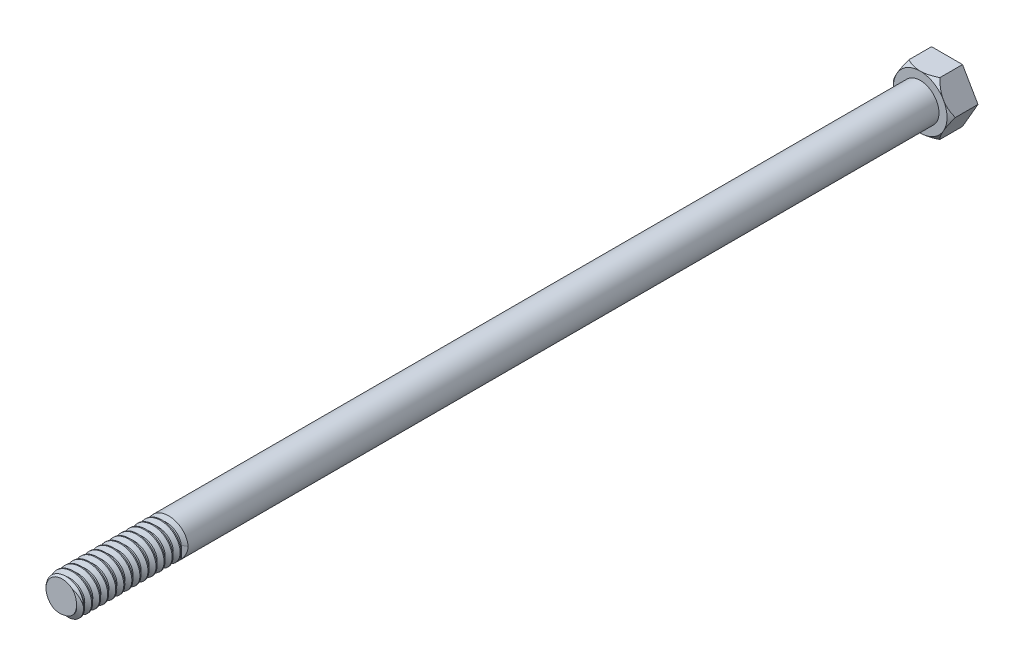
from build123d import *

# Parameters (mm, degrees)
BOSS_EXTRUDE1_DEPTH = 2.5
SKETCH3_OUTSIDE_W   = 37.02
SKETCH3_OUTSIDE_H   = 35.472
SKETCH3_OUTSIDE_R   = 5
CUT_EXTRUDE1_DEPTH  = 10.128709292
CUT_EXTRUDE1_DRAFT  = -45
SKETCH4_R           = 3.5
BOSS_EXTRUDE2_DEPTH = 160
CHAMFER1_SIZE       = 0.5
THREAD1_PITCH       = 1.5
CUT_EXTRUDE2_DEPTH  = 163.679388264
CUT_EXTRUDE4_DEPTH  = 2.5


with BuildPart() as part:
    # Sketch2 → Boss-Extrude1 (new, symmetric)
    with BuildSketch(Plane.XY):
        Polygon((-2.886751346, 5), (-5.773502692, 0), (-2.886751346, -5), (2.886751346, -5), (5.773502692, 0), (2.886751346, 5), align=None)
    extrude(amount=BOSS_EXTRUDE1_DEPTH, both=True)


with BuildPart() as cut_extrude1_tool:
    # Sketch3 outside → Cut-Extrude1 (with draft: the straight prism first)
    with BuildSketch(Plane.XY.offset(2.5)):
        Rectangle(SKETCH3_OUTSIDE_W, SKETCH3_OUTSIDE_H)
        Circle(SKETCH3_OUTSIDE_R, mode=Mode.SUBTRACT)
    extrude(amount=-CUT_EXTRUDE1_DEPTH)
    # Cut-Extrude1: the draft: its side faces are tilted about the plane it starts from
    cut_extrude1_sides = [cut_extrude1_tool.faces().sort_by_distance(p)[0] for p in [
        (0, -17.736, -2.564354646),
        (18.51, 0, -2.564354646),
        (0, 17.736, -2.564354646),
        (-18.51, 0, -2.564354646),
        (-5, 0, -2.564354646),
    ]]
    draft(cut_extrude1_sides, Plane.XY.offset(2.5), CUT_EXTRUDE1_DRAFT)


with BuildPart() as part_1:
    add(part.part)

    # Cut-Extrude1: cut by cut_extrude1_tool
    add(cut_extrude1_tool.part, mode=Mode.SUBTRACT)

    # Sketch4 → Boss-Extrude2 (add)
    with BuildSketch(Plane.XY.offset(2.5)):
        Circle(SKETCH4_R)
    extrude(amount=BOSS_EXTRUDE2_DEPTH)

    # Chamfer1
    chamfer1_edges = [part_1.edges().sort_by_distance(p)[0] for p in [
        (-3.5, 0, 162.5),
    ]]
    chamfer(chamfer1_edges, length=CHAMFER1_SIZE)

    # Thread1: the profile of Thread Profile1 profile screwed along a right-hand helix of 13.333333 turns, 8 arcs to a turn; built about Z, then put on its axis
    thread1_z = Axis((0, 0, 0), (0, 0, 1))
    thread1_corners = [(3.5003, 0, -0.000173205), (3.5003, 0, 1.312673201), (2.688101188, 0, 0.843749998), (2.688101188, 0, 0.468749998)]
    with BuildLine(mode=Mode.PRIVATE) as thread1_profile:
        Line(thread1_corners[0], thread1_corners[1])
        Line(thread1_corners[1], thread1_corners[2])
        Line(thread1_corners[2], thread1_corners[3])
        Line(thread1_corners[3], thread1_corners[0])
    thread1_cap = Face(thread1_profile.wire())
    thread1_turn_angles = [0, 22.5, 45, 67.5, 90, 112.5, 135, 157.5, 180, 202.5, 225, 247.5, 270, 292.5, 315, 337.5, 360]
    thread1_turn_weights = [1, 0.9238795325112867, 1, 0.9238795325112867, 1, 0.9238795325112867, 1, 0.9238795325112867, 1, 0.9238795325112867, 1, 0.9238795325112867, 1, 0.9238795325112867, 1, 0.9238795325112867, 1]
    thread1_turn_rails = [Edge.make_bspline([Vector(p[0], p[1], 0).rotate(thread1_z, thread1_turn_angles[k]) / thread1_turn_weights[k] + Vector(0, 0, p[2] + THREAD1_PITCH * thread1_turn_angles[k] / 360) for k in range(17)], [0, 0, 0, 1, 1, 2, 2, 3, 3, 4, 4, 5, 5, 6, 6, 7, 7, 8, 8, 8], 2, thread1_turn_weights) for p in thread1_corners]
    thread1_turn_sides = [Face.make_surface_from_curves(thread1_turn_rails[p[0]], thread1_turn_rails[p[1]]) for p in [(0, 1), (1, 2), (2, 3), (3, 0)]]
    thread1_last_angles = [4680, 4702.5, 4725, 4747.5, 4770, 4785, 4800]
    thread1_last_weights = [1, 0.9238795325112867, 1, 0.9238795325112867, 1, 0.9659258262890744, 1]
    thread1_last_rails = [Edge.make_bspline([Vector(p[0], p[1], 0).rotate(thread1_z, thread1_last_angles[k]) / thread1_last_weights[k] + Vector(0, 0, p[2] + THREAD1_PITCH * thread1_last_angles[k] / 360) for k in range(7)], [0, 0, 0, 1, 1, 2, 2, 3, 3, 3], 2, thread1_last_weights) for p in thread1_corners]
    thread1_last_sides = [Face.make_surface_from_curves(thread1_last_rails[p[0]], thread1_last_rails[p[1]]) for p in [(0, 1), (1, 2), (2, 3), (3, 0)]]
    thread1 = Plane(origin=(0, 0, 142.5), x_dir=(1, 0, 0), z_dir=(0, 0, 1)) * Solid(Shell([*[p.moved(Location((0, 0, THREAD1_PITCH * i))) for i in range(13) for p in thread1_turn_sides], *thread1_last_sides, thread1_cap, thread1_cap.rotate(thread1_z, 4800).moved(Location((0, 0, THREAD1_PITCH * 4800 / 360)))]))
    add(thread1, mode=Mode.SUBTRACT)

    # Sketch12 → Cut-Extrude2 (cut, through all)
    with BuildSketch(Plane(origin=(0, 0, 0), x_dir=(1, 0, 0), z_dir=(0, 1, 0))):
        Polygon((3.5, -142.5), (2.688101188, -142.968749998), (2.688101188, -143.343749998), (3.5, -143.812499996), align=None)
    extrude(amount=-CUT_EXTRUDE2_DEPTH, mode=Mode.SUBTRACT)

    # Sketch13 → Cut-Extrude4 (cut)
    with BuildSketch(Plane(origin=(0, 0, -2.5), x_dir=(-1, 0, 0), z_dir=(0, 0, -1))):
        Polygon((2.517660098, 1.412345909), (0.035702613, 2.886530557), (-2.481957485, 1.474184649), (-2.517660098, -1.412345909), (-0.035702613, -2.886530557), (2.481957485, -1.474184649), align=None)
    extrude(amount=-CUT_EXTRUDE4_DEPTH, mode=Mode.SUBTRACT)


solid = part_1.part
